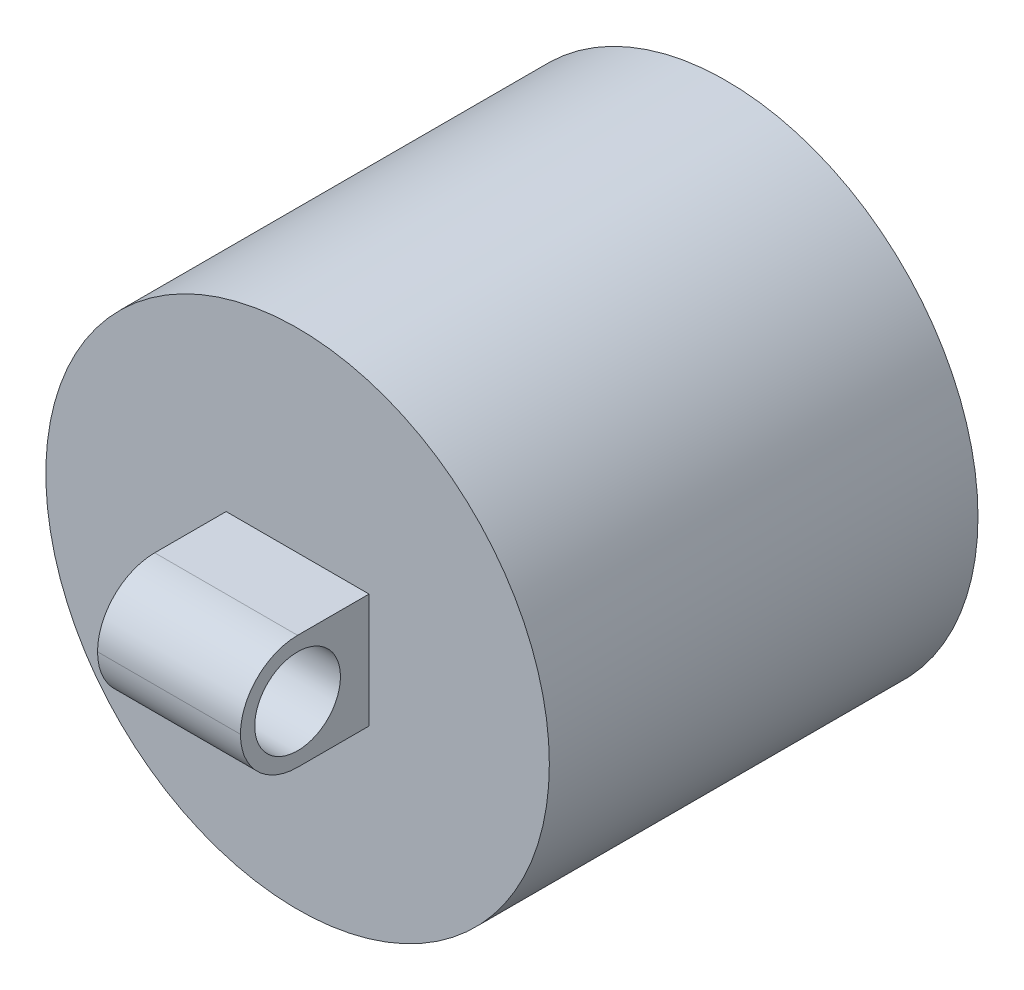
from build123d import *

# Parameters (mm, degrees)
SKETCH1_R           = 8.81
BOSS_EXTRUDE1_DEPTH = 15
SKETCH2_W           = 5
SKETCH2_H           = 4
BOSS_EXTRUDE2_DEPTH = 4.5
FILLET7_R           = 2
SKETCH3_R           = 1.5
CUT_EXTRUDE1_DEPTH  = 25.202937838


with BuildPart() as part:
    # Sketch1 → Boss-Extrude1 (new body)
    with BuildSketch(Plane.XY):
        Circle(SKETCH1_R)
    extrude(amount=BOSS_EXTRUDE1_DEPTH)

    # Sketch2 → Boss-Extrude2 (add)
    with BuildSketch(Plane.XY.offset(15)):
        Rectangle(SKETCH2_W, SKETCH2_H)
    extrude(amount=BOSS_EXTRUDE2_DEPTH)

    # Fillet7
    fillet7_edges = [part.edges().sort_by_distance(p)[0] for p in [
        (0, 2, 19.5),
        (0, -2, 19.5),
    ]]
    fillet(fillet7_edges, radius=FILLET7_R - 0.0001)  # a hair under: the kernel refuses the full size

    # Sketch3 → Cut-Extrude1 (cut, through all)
    with BuildSketch(Plane(origin=(2.5, 0, 0), x_dir=(0, 0, -1), z_dir=(1, 0, 0))):
        with Locations((-17.5, 0)):
            Circle(SKETCH3_R)
    extrude(amount=-CUT_EXTRUDE1_DEPTH, mode=Mode.SUBTRACT)


solid = part.part
